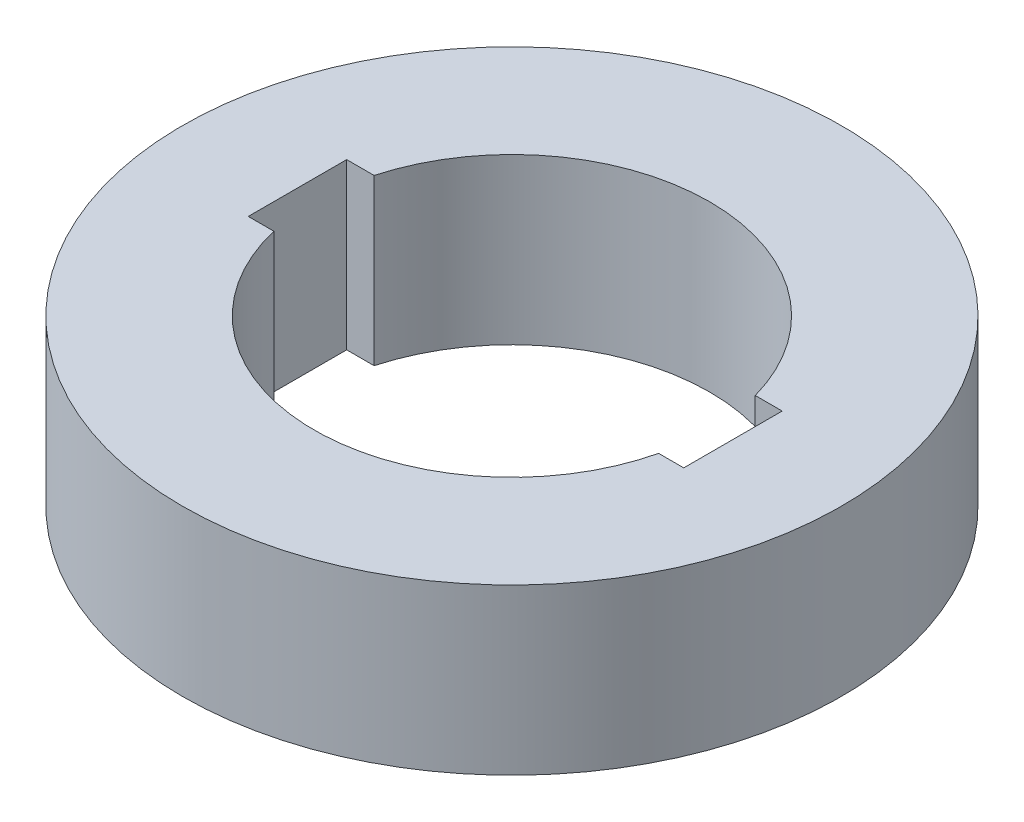
from build123d import *

# Parameters (mm, degrees)
SKETCH2_R           = 50
BOSS_EXTRUDE1_DEPTH = 25


with BuildPart() as part:
    # Sketch2 → Boss-Extrude1 (new body)
    with BuildSketch(Plane(origin=(0, 0, 0), x_dir=(1, 0, 0), z_dir=(0, 1, 0))):
        Circle(SKETCH2_R)
        with BuildLine():
            Line((28.91366459, 8), (33, 8))
            Line((33, 8), (33, -6.931922532))
            Line((33, -6.931922532), (29.188155989, -6.931922532))
            ThreePointArc((29.188155989, -6.931922532), (0, -30), (-29.188155989, -6.931922532))
            Line((-29.188155989, -6.931922532), (-33.071968377, -6.931922532))
            Line((-33.071968377, -6.931922532), (-33.071968377, 8))
            Line((-33.071968377, 8), (-28.91366459, 8))
            ThreePointArc((-28.91366459, 8), (0, 30), (28.91366459, 8))
        make_face(mode=Mode.SUBTRACT)
    extrude(amount=BOSS_EXTRUDE1_DEPTH)


solid = part.part
